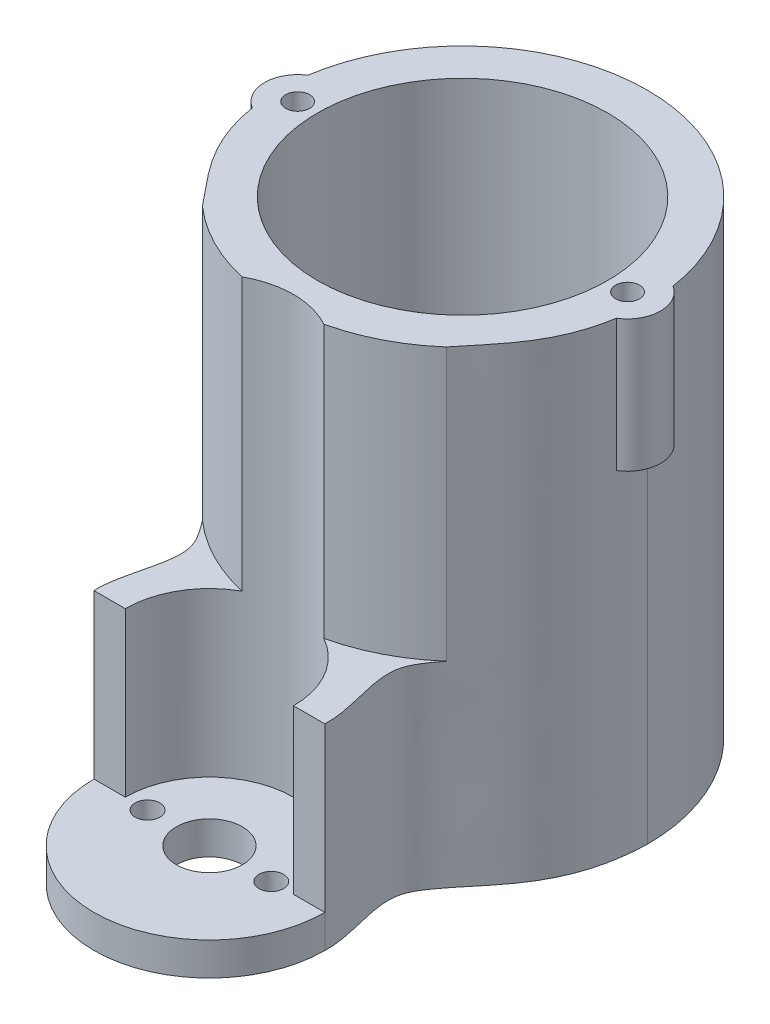
from build123d import *

# Parameters (mm, degrees)
SKETCH1_R              = 17.6
BOSS_EXTRUDE1_DEPTH    = 56.8
BOSS_EXTRUDE2_DEPTH    = 4
SKETCH4_R              = 4
SKETCH4_R_2            = 1.5
CUT_EXTRUDE1_DEPTH     = 4
BOSS_EXTRUDE3_DEPTH    = 16
CUT_EXTRUDE2_START     = -14
CUT_EXTRUDE2_OUTLINE_R = 1.45
CUT_EXTRUDE2_DEPTH     = 14
CUT_EXTRUDE3_DEPTH     = 33


# Read off the part's stored shape, not the designer's step: Cut-Extrude2
with BuildPart() as part:
    # Sketch1 → Boss-Extrude1 (new body)
    with BuildSketch(Plane(origin=(0, 0, 0), x_dir=(1, 0, 0), z_dir=(0, 1, 0))):
        with BuildLine():
            Line((-14, -30.7), (-10.2, -30.7))
            ThreePointArc((-10.2, -30.7), (0, -20.5), (10.2, -30.7))
            Line((10.2, -30.7), (14, -30.7))
            add(Edge.make_bspline(
                [(22.4, 0), (22.107939007, -9.890498416), (16.256040946, -13.947885017), (11.388120446, -21.994772931), (14.153535086, -27.339514928), (14, -30.7)],
                knots=[0, 0, 0, 0, 0.589197799, 0.689197799, 1, 1, 1, 1], degree=3))
            ThreePointArc((22.4, 0), (0, 22.4), (-22.4, 0))
            add(Edge.make_bspline(
                [(-22.4, 0), (-22.107939007, -9.890498416), (-16.256040946, -13.947885017), (-11.388120446, -21.994772931), (-14.153535086, -27.339514928), (-14, -30.7)],
                knots=[0, 0, 0, 0, 0.589197799, 0.689197799, 1, 1, 1, 1], degree=3))
        make_face()
        with Locations(Location((0, 0, 0), (0, 0, 270))):
            Circle(SKETCH1_R, mode=Mode.SUBTRACT)
    extrude(amount=BOSS_EXTRUDE1_DEPTH)

    # Sketch3 → Boss-Extrude2 (add)
    with BuildSketch(Plane.XZ):
        with BuildLine():
            ThreePointArc((-14, 30.7), (0, 44.7), (14, 30.7))
            add(Edge.make_bspline(
                [(-14, 30.7), (-12.62265513, 25.007813603), (0.167580012, 13.239499872), (11.954859233, 25.492817672), (14, 30.7)],
                knots=[0, 0, 0, 0, 0.503384006, 1, 1, 1, 1], degree=3))
        make_face()
    extrude(amount=-BOSS_EXTRUDE2_DEPTH)

    # Sketch4 → Cut-Extrude1 (cut)
    with BuildSketch(Plane.XZ):
        with Locations(Location((0, 30.7, 0), (0, 0, 270))):
            Circle(SKETCH4_R)
        with Locations(Location((-7.5, 30.7, 0), (0, 0, 270))):
            Circle(SKETCH4_R_2)
        with Locations(Location((7.5, 30.7, 0), (0, 0, 270))):
            Circle(SKETCH4_R_2)
    extrude(amount=-CUT_EXTRUDE1_DEPTH, mode=Mode.SUBTRACT)

    # Sketch5 → Boss-Extrude3 (add)
    with BuildSketch(Plane(origin=(0, 56.8, 0), x_dir=(1, 0, 0), z_dir=(0, 1, 0))):
        with BuildLine():
            Line((20, 4), (20, -4))
            ThreePointArc((20, -4), (24, 0), (20, 4))
        make_face()
        with BuildLine():
            Line((-20, 4), (-20, -4))
            ThreePointArc((-20, -4), (-24, 0), (-20, 4))
        make_face()
    extrude(amount=-BOSS_EXTRUDE3_DEPTH)

    # Cut-Extrude2 outline → Cut-Extrude2 (cut)
    with BuildSketch(Plane(origin=(0, 56.8, 0), x_dir=(1, 0, 0), z_dir=(0, 1, 0)).offset(CUT_EXTRUDE2_START)):
        with Locations((20, 0)):
            Circle(CUT_EXTRUDE2_OUTLINE_R)
        with Locations((-20, 0)):
            Circle(CUT_EXTRUDE2_OUTLINE_R)
    extrude(amount=CUT_EXTRUDE2_DEPTH, mode=Mode.SUBTRACT)

    # Sketch7 → Cut-Extrude3 (cut)
    with BuildSketch(Plane(origin=(0, 56.8, 0), x_dir=(1, 0, 0), z_dir=(0, 1, 0))):
        with BuildLine():
            Line((-22.083760266, -3.414373025), (-36.083760266, -3.414373025))
            ThreePointArc((-36.083760266, -3.414373025), (0, -36.244940311), (36.083760266, -3.414373025))
            Line((36.083760266, -3.414373025), (22.083760266, -3.414373025))
            ThreePointArc((22.083760266, -3.414373025), (0, -22.346149795), (-22.083760266, -3.414373025))
        make_face()
    extrude(amount=-CUT_EXTRUDE3_DEPTH, mode=Mode.SUBTRACT)


solid = part.part
